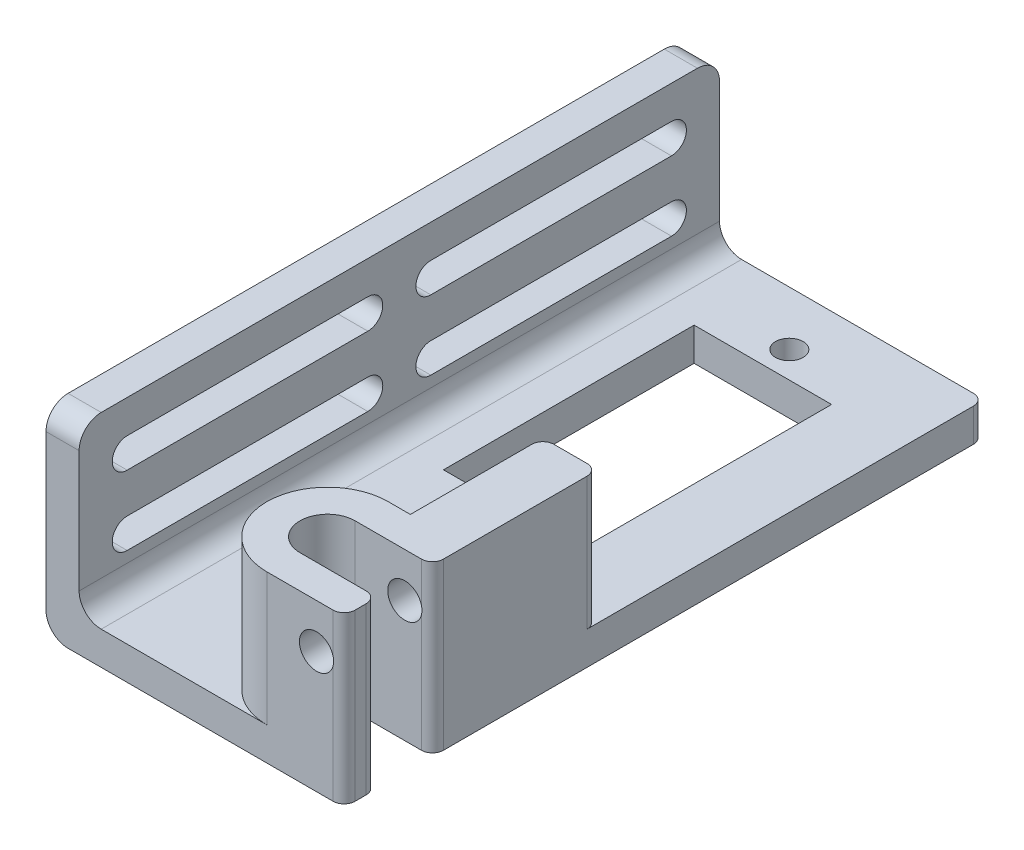
from build123d import *

# Parameters (mm, degrees)
BOSS_EXTRUDE1_DEPTH = 3
SKETCH2_R           = 1.25
SKETCH2_W           = 12.45
SKETCH2_H           = 22.7
CUT_EXTRUDE1_DEPTH  = 3
SKETCH3_W           = 3
SKETCH3_H           = 58
BOSS_EXTRUDE2_DEPTH = 15
BOSS_EXTRUDE3_DEPTH = 12
FILLET1_R           = 2
FILLET2_R           = 2
FILLET3_R           = 1
CUT_EXTRUDE2_DEPTH  = 3
SKETCH7_R           = 1.55
CUT_EXTRUDE3_DEPTH  = 48.728398255


with BuildPart() as part:
    # Sketch1 → Boss-Extrude1 (new body)
    with BuildSketch(Plane(origin=(0, 0, 0), x_dir=(1, 0, 0), z_dir=(0, 1, 0))):
        with BuildLine():
            Line((27, 8), (20, 8))
            ThreePointArc((20, 8), (17.5, 5.5), (20, 3))
            Line((20, 3), (27, 3))
            Line((27, 3), (27, 0))
            Line((27, 0), (0, 0))
            Line((0, 0), (0, 58))
            Line((0, 58), (27, 58))
            Line((27, 58), (27, 8))
        make_face()
    extrude(amount=BOSS_EXTRUDE1_DEPTH)

    # Sketch2 → Cut-Extrude1 (cut)
    with BuildSketch(Plane(origin=(0, 3, 0), x_dir=(1, 0, 0), z_dir=(0, 1, 0))):
        with Locations((14.225, 53.1)):
            Circle(SKETCH2_R)
        with Locations((14.225, 25.6)):
            Circle(SKETCH2_R)
        with Locations((14.225, 39.35)):
            Rectangle(SKETCH2_W, SKETCH2_H)
    extrude(amount=-CUT_EXTRUDE1_DEPTH, mode=Mode.SUBTRACT)

    # Sketch3 → Boss-Extrude2 (add)
    with BuildSketch(Plane(origin=(0, 3, 0), x_dir=(1, 0, 0), z_dir=(0, 1, 0))):
        with Locations((1.5, 29)):
            Rectangle(SKETCH3_W, SKETCH3_H)
    extrude(amount=BOSS_EXTRUDE2_DEPTH)

    # Sketch4 → Boss-Extrude3 (add)
    with BuildSketch(Plane(origin=(0, 3, 0), x_dir=(1, 0, 0), z_dir=(0, 1, 0))):
        with BuildLine():
            Line((20, 11), (22, 11))
            Line((22, 11), (22, 23))
            Line((22, 23), (27, 23))
            Line((27, 23), (27, 11))
            Line((27, 11), (27, 8))
            Line((27, 8), (20, 8))
            ThreePointArc((20, 8), (17.5, 5.5), (20, 3))
            Line((20, 3), (27, 3))
            Line((27, 3), (27, 0))
            Line((27, 0), (20, 0))
            ThreePointArc((20, 0), (14.5, 5.5), (20, 11))
        make_face()
    extrude(amount=BOSS_EXTRUDE3_DEPTH)

    # Fillet1
    fillet1_edges = [part.edges().sort_by_distance(p)[0] for p in [
        (3, 3, -29),
        (0, 0, -29),
    ]]
    fillet(fillet1_edges, radius=FILLET1_R)

    # Fillet2
    fillet2_edges = [part.edges().sort_by_distance(p)[0] for p in [
        (1.5, 18, -58),
        (1.5, 18, 0),
    ]]
    fillet(fillet2_edges, radius=FILLET2_R)

    # Fillet3
    fillet3_edges = [part.edges().sort_by_distance(p)[0] for p in [
        (27, 9, -23),
        (22, 9, -23),
        (27, 7.5, -8),
        (27, 7.5, -3),
        (27, 7.5, 0),
        (27, 1.5, -58),
    ]]
    fillet(fillet3_edges, radius=FILLET3_R)

    # Sketch5 → Cut-Extrude2 (cut)
    with BuildSketch(Plane.ZY):
        with BuildLine():
            Line((-53.65, 15), (-31.85, 15))
            ThreePointArc((-31.85, 15), (-30.5, 13.65), (-31.85, 12.3))
            Line((-31.85, 12.3), (-53.65, 12.3))
            ThreePointArc((-53.65, 12.3), (-55, 13.65), (-53.65, 15))
        make_face()
        with BuildLine():
            Line((-53.65, 8.7), (-31.85, 8.7))
            ThreePointArc((-31.85, 8.7), (-30.5, 7.35), (-31.85, 6))
            Line((-31.85, 6), (-53.65, 6))
            ThreePointArc((-53.65, 6), (-55, 7.35), (-53.65, 8.7))
        make_face()
        with BuildLine():
            Line((-26.15, 15), (-4.35, 15))
            ThreePointArc((-4.35, 15), (-3, 13.65), (-4.35, 12.3))
            Line((-4.35, 12.3), (-26.15, 12.3))
            ThreePointArc((-26.15, 12.3), (-27.5, 13.65), (-26.15, 15))
        make_face()
        with BuildLine():
            Line((-26.15, 8.7), (-4.35, 8.7))
            ThreePointArc((-4.35, 8.7), (-3, 7.35), (-4.35, 6))
            Line((-4.35, 6), (-26.15, 6))
            ThreePointArc((-26.15, 6), (-27.5, 7.35), (-26.15, 8.7))
        make_face()
    extrude(amount=-CUT_EXTRUDE2_DEPTH, mode=Mode.SUBTRACT)

    # Sketch7 → Cut-Extrude3 (cut, through all)
    with BuildSketch(Plane(origin=(0, 0, -23), x_dir=(-1, 0, 0), z_dir=(0, 0, -1))):
        with Locations((-24.5, 11)):
            Circle(SKETCH7_R)
    extrude(amount=-CUT_EXTRUDE3_DEPTH, mode=Mode.SUBTRACT)


solid = part.part
